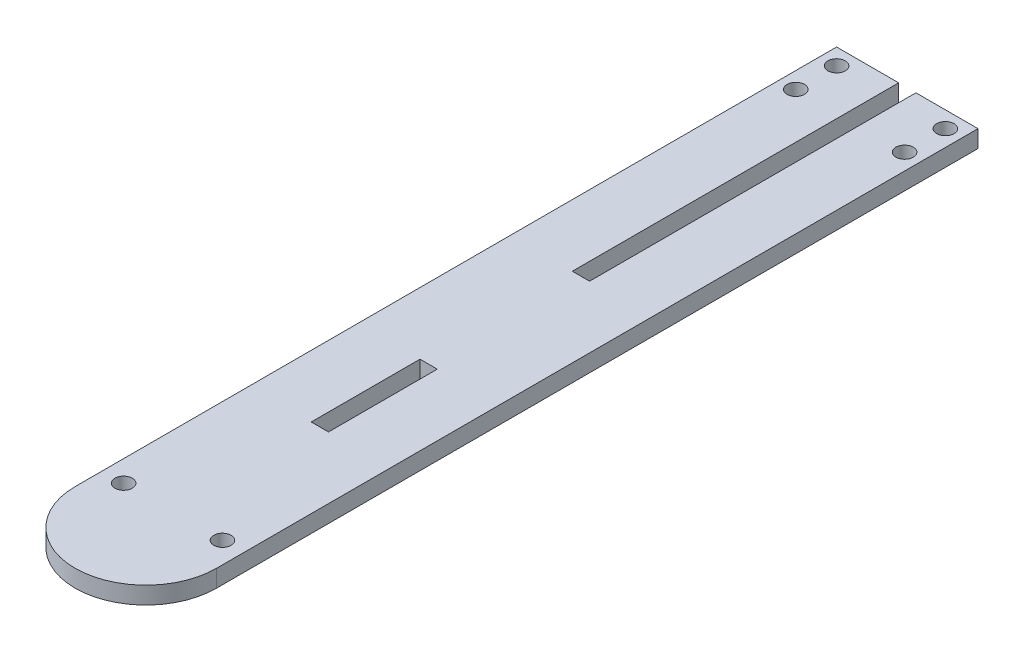
from build123d import *

# Parameters (mm, degrees)
SKETCH1_W               = 3.175
SKETCH1_H               = 20
BOSS_EXTRUDE1_DEPTH     = 3.175
CUT_EXTRUDE2_DEPTH      = 154.72662678
CUT_EXTRUDE2_DEPTH_BACK = 154.72662678
SKETCH4_R               = 1.6
CUT_EXTRUDE3_DEPTH      = 154.72662678
CUT_EXTRUDE3_DEPTH_BACK = 154.72662678
SKETCH5_R               = 1.6


with BuildPart() as part:
    # Sketch1 → Boss-Extrude1 (new body)
    with BuildSketch(Plane(origin=(0, 0, 0), x_dir=(1, 0, 0), z_dir=(0, 1, 0))):
        with BuildLine():
            Line((-14.5875, 0), (-14.5875, -140))
            ThreePointArc((-14.5875, -140), (-1.5875, -153), (11.4125, -140))
            Line((11.4125, -140), (11.4125, 0))
            Line((11.4125, 0), (0, 0))
            Line((0, 0), (0, -60))
            Line((0, -60), (-3.175, -60))
            Line((-3.175, -60), (-3.175, 0))
            Line((-3.175, 0), (-14.5875, 0))
        make_face()
        with Locations((-1.5875, -98)):
            Rectangle(SKETCH1_W, SKETCH1_H, mode=Mode.SUBTRACT)
    extrude(amount=BOSS_EXTRUDE1_DEPTH)

    # Sketch4 → Cut-Extrude2 (cut, two sides: drawn at the far end of the back side and taken through both)
    with BuildSketch(Plane.XZ.offset(-CUT_EXTRUDE2_DEPTH_BACK)):
        with Locations((8.4125, 3)):
            Circle(SKETCH4_R)
        with Locations((8.4125, 10.5)):
            Circle(SKETCH4_R)
        with Locations((-11.5875, 10.5)):
            Circle(SKETCH4_R)
        with Locations((-11.5875, 3)):
            Circle(SKETCH4_R)
    extrude(amount=CUT_EXTRUDE2_DEPTH + CUT_EXTRUDE2_DEPTH_BACK, mode=Mode.SUBTRACT)

    # Sketch5 → Cut-Extrude3 (cut, two sides: drawn at the far end of the back side and taken through both)
    with BuildSketch(Plane(origin=(0, 3.175, 0), x_dir=(1, 0, 0), z_dir=(0, 1, 0)).offset(-CUT_EXTRUDE3_DEPTH_BACK)):
        with Locations((-10.675, -135)):
            Circle(SKETCH5_R)
        with Locations((7.5, -135)):
            Circle(SKETCH5_R)
    extrude(amount=CUT_EXTRUDE3_DEPTH + CUT_EXTRUDE3_DEPTH_BACK, mode=Mode.SUBTRACT)


solid = part.part
